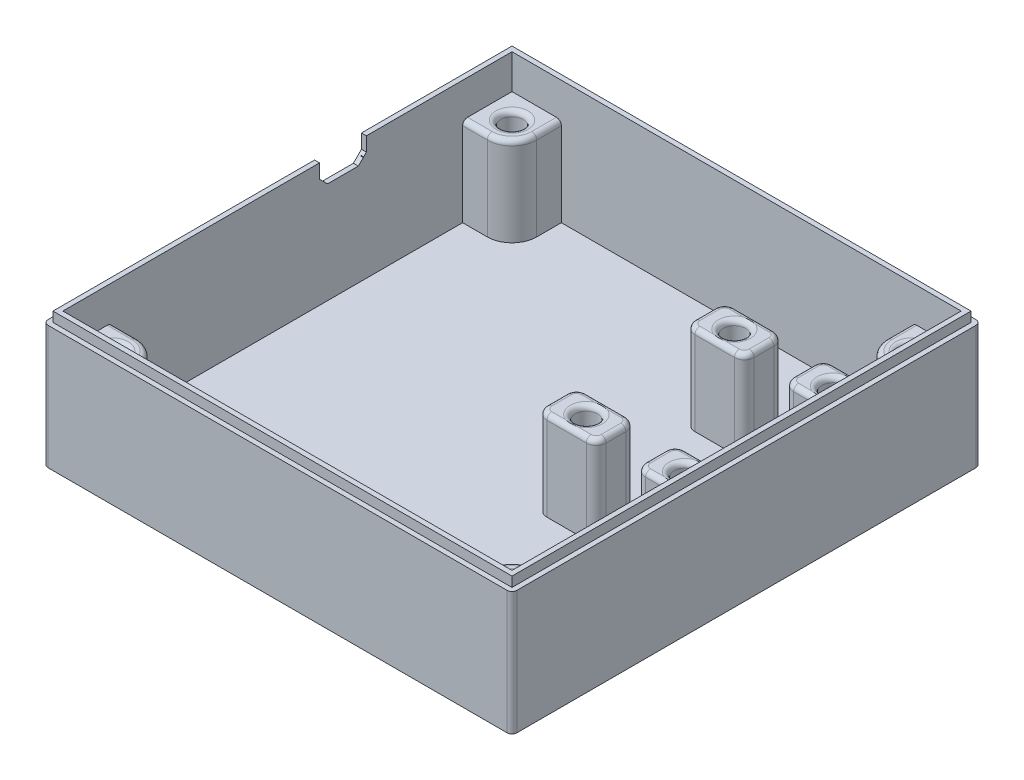
from build123d import *

# Parameters (mm, degrees)
SKETCH1_W           = 95
SKETCH1_H           = 95
BOSS_EXTRUDE1_DEPTH = 2
SKETCH2_W           = 95
SKETCH2_H           = 95
SKETCH2_W_2         = 91
SKETCH2_H_2         = 91
BOSS_EXTRUDE2_DEPTH = 25
BOSS_EXTRUDE3_DEPTH = 18
SKETCH4_R           = 2.25
CUT_EXTRUDE1_DEPTH  = 18
SKETCH6_R           = 2.25
BOSS_EXTRUDE4_DEPTH = 18
FILLET1_R           = 1
FILLET2_R           = 1
CUT_EXTRUDE2_REACH  = 111.591
CUT_EXTRUDE3_REACH  = 74.398
SKETCH8_W           = 0.5
SKETCH8_H           = 1.5
CUT_EXTRUDE4_DEPTH  = 0.8
FILLET3_R           = 1
FILLET4_R           = 1
SKETCH11_W          = 93
SKETCH11_H          = 93
CUT_EXTRUDE6_DEPTH  = 2
CUT_EXTRUDE7_REACH  = 110.899
CUT_EXTRUDE8_REACH  = 73.676
CUT_EXTRUDE9_DEPTH  = 1
FILLET5_R           = 1


with BuildPart() as part:
    # Sketch1 → Boss-Extrude1 (new body)
    with BuildSketch(Plane(origin=(0, 0, 0), x_dir=(1, 0, 0), z_dir=(0, 1, 0))):
        Rectangle(SKETCH1_W, SKETCH1_H)
    extrude(amount=BOSS_EXTRUDE1_DEPTH)

    # Sketch2 → Boss-Extrude2 (add)
    with BuildSketch(Plane(origin=(0, 2, 0), x_dir=(1, 0, 0), z_dir=(0, 1, 0))):
        Rectangle(SKETCH2_W, SKETCH2_H)
        Rectangle(SKETCH2_W_2, SKETCH2_H_2, mode=Mode.SUBTRACT)
    extrude(amount=BOSS_EXTRUDE2_DEPTH)

    # Sketch3 → Boss-Extrude3 (add)
    with BuildSketch(Plane(origin=(0, 2, 0), x_dir=(1, 0, 0), z_dir=(0, 1, 0))):
        with BuildLine():
            Line((-45.5, 45.5), (-35.5, 45.5))
            Line((-35.5, 45.5), (-35.5, 40.5))
            ThreePointArc((-35.5, 40.5), (-36.964466094, 36.964466094), (-40.5, 35.5))
            Line((-40.5, 35.5), (-45.5, 35.5))
            Line((-45.5, 35.5), (-45.5, 45.5))
        make_face()
        with BuildLine():
            Line((35.5, 45.5), (35.5, 40.5))
            ThreePointArc((35.5, 40.5), (36.964466094, 36.964466094), (40.5, 35.5))
            Line((40.5, 35.5), (45.5, 35.5))
            Line((45.5, 35.5), (45.5, 45.5))
            Line((45.5, 45.5), (35.5, 45.5))
        make_face()
        with BuildLine():
            Line((45.5, -45.5), (35.5, -45.5))
            Line((35.5, -45.5), (35.5, -40.5))
            ThreePointArc((35.5, -40.5), (36.964466094, -36.964466094), (40.5, -35.5))
            Line((40.5, -35.5), (45.5, -35.5))
            Line((45.5, -35.5), (45.5, -45.5))
        make_face()
        with BuildLine():
            Line((-35.5, -45.5), (-35.5, -40.5))
            ThreePointArc((-35.5, -40.5), (-36.964466094, -36.964466094), (-40.5, -35.5))
            Line((-40.5, -35.5), (-45.5, -35.5))
            Line((-45.5, -35.5), (-45.5, -45.5))
            Line((-45.5, -45.5), (-35.5, -45.5))
        make_face()
    extrude(amount=BOSS_EXTRUDE3_DEPTH)

    # Sketch4 → Cut-Extrude1 (cut)
    with BuildSketch(Plane(origin=(0, 20, 0), x_dir=(1, 0, 0), z_dir=(0, 1, 0))):
        with Locations(Location((-40.5, 40.5, 0), (0, 0, 270))):
            Circle(SKETCH4_R)
        with Locations(Location((40.5, 40.5, 0), (0, 0, 270))):
            Circle(SKETCH4_R)
        with Locations(Location((40.5, -40.5, 0), (0, 0, 270))):
            Circle(SKETCH4_R)
        with Locations(Location((-40.5, -40.5, 0), (0, 0, 270))):
            Circle(SKETCH4_R)
    extrude(amount=-CUT_EXTRUDE1_DEPTH, mode=Mode.SUBTRACT)

    # Sketch6 → Boss-Extrude4 (add)
    # profile 1 of 4: a face of its own
    with BuildSketch(Plane(origin=(0, 2, 0), x_dir=(1, 0, 0), z_dir=(0, 1, 0))):
        with BuildLine():
            Line((14.69, 30.37), (22.69, 30.37))
            ThreePointArc((22.69, 30.37), (24.104213562, 29.784213562), (24.69, 28.37))
            Line((24.69, 28.37), (24.69, 24.37))
            ThreePointArc((24.69, 24.37), (24.104213562, 22.955786438), (22.69, 22.37))
            Line((22.69, 22.37), (14.69, 22.37))
            ThreePointArc((14.69, 22.37), (13.275786438, 22.955786438), (12.69, 24.37))
            Line((12.69, 24.37), (12.69, 28.37))
            ThreePointArc((12.69, 28.37), (13.275786438, 29.784213562), (14.69, 30.37))
        make_face()
        with Locations(Location((18.69, 26.37, 0), (0, 0, 90))):
            Circle(SKETCH6_R, mode=Mode.SUBTRACT)
    # profile 2 of 4: a face of its own
    with BuildSketch(Plane(origin=(0, 2, 0), x_dir=(1, 0, 0), z_dir=(0, 1, 0))):
        with BuildLine():
            Line((45.5, 30.37), (45.5, 22.37))
            Line((45.5, 22.37), (34.69, 22.37))
            ThreePointArc((34.69, 22.37), (33.275786438, 22.955786438), (32.69, 24.37))
            Line((32.69, 24.37), (32.69, 28.37))
            ThreePointArc((32.69, 28.37), (33.275786438, 29.784213562), (34.69, 30.37))
            Line((34.69, 30.37), (45.5, 30.37))
        make_face()
        with Locations(Location((38.69, 26.37, 0), (0, 0, 90))):
            Circle(SKETCH6_R, mode=Mode.SUBTRACT)
    # profile 3 of 4: a face of its own
    with BuildSketch(Plane(origin=(0, 2, 0), x_dir=(1, 0, 0), z_dir=(0, 1, 0))):
        with BuildLine():
            Line((14.69, 0.37), (22.69, 0.37))
            ThreePointArc((22.69, 0.37), (24.104213562, -0.215786438), (24.69, -1.63))
            Line((24.69, -1.63), (24.69, -5.63))
            ThreePointArc((24.69, -5.63), (24.104213562, -7.044213562), (22.69, -7.63))
            Line((22.69, -7.63), (14.69, -7.63))
            ThreePointArc((14.69, -7.63), (13.275786438, -7.044213562), (12.69, -5.63))
            Line((12.69, -5.63), (12.69, -1.63))
            ThreePointArc((12.69, -1.63), (13.275786438, -0.215786438), (14.69, 0.37))
        make_face()
        with Locations(Location((18.69, -3.63, 0), (0, 0, 90))):
            Circle(SKETCH6_R, mode=Mode.SUBTRACT)
    # profile 4 of 4: a face of its own
    with BuildSketch(Plane(origin=(0, 2, 0), x_dir=(1, 0, 0), z_dir=(0, 1, 0))):
        with BuildLine():
            Line((45.5, 0.37), (45.5, -7.63))
            Line((45.5, -7.63), (34.69, -7.63))
            ThreePointArc((34.69, -7.63), (33.275786438, -7.044213562), (32.69, -5.63))
            Line((32.69, -5.63), (32.69, -1.63))
            ThreePointArc((32.69, -1.63), (33.275786438, -0.215786438), (34.69, 0.37))
            Line((34.69, 0.37), (45.5, 0.37))
        make_face()
        with Locations(Location((38.69, -3.63, 0), (0, 0, 90))):
            Circle(SKETCH6_R, mode=Mode.SUBTRACT)
    extrude(amount=BOSS_EXTRUDE4_DEPTH)

    # Fillet1
    # the kernel refuses this fillet: 1 mm, written as the material it takes off along each edge
    with BuildSketch(Plane(origin=(14.69, 20, 5.63), x_dir=(0, 0, 1), z_dir=(1, 0, 0))) as fillet1_piece_1:
        with BuildLine():
            CenterArc((2 - FILLET1_R, FILLET1_R), FILLET1_R, 270, 90)
            Line((2 - FILLET1_R, 0), (2, 0))
            Line((2, 0), (2, FILLET1_R))
        make_face()
    revolve(axis=Axis((14.69, 20, 5.63), (0, -1, 0)), revolution_arc=90, mode=Mode.SUBTRACT)
    with BuildSketch(Plane(origin=(22.69, 20, 7.63), x_dir=(0, -1, 0), z_dir=(-1, 0, 0)), Plane(origin=(14.69, 20, -0.37), x_dir=(0, -1, 0), z_dir=(1, 0, 0)), Plane(origin=(14.69, 20, -30.37), x_dir=(0, -1, 0), z_dir=(1, 0, 0)), Plane(origin=(22.69, 20, -22.37), x_dir=(0, -1, 0), z_dir=(-1, 0, 0))) as fillet1_piece_2:
        with BuildLine():
            CenterArc((FILLET1_R, -FILLET1_R), FILLET1_R, 90, 90)
            Line((0, -FILLET1_R), (0, 0))
            Line((0, 0), (FILLET1_R, 0))
        make_face()
    extrude(amount=8, mode=Mode.SUBTRACT)
    with BuildSketch(Plane(origin=(22.69, 20, 5.63), x_dir=(1, 0, 0), z_dir=(0, 0, -1))) as fillet1_piece_3:
        with BuildLine():
            CenterArc((2 - FILLET1_R, FILLET1_R), FILLET1_R, 270, 90)
            Line((2 - FILLET1_R, 0), (2, 0))
            Line((2, 0), (2, FILLET1_R))
        make_face()
    revolve(axis=Axis((22.69, 20, 5.63), (0, -1, 0)), revolution_arc=90, mode=Mode.SUBTRACT)
    with BuildSketch(Plane(origin=(24.69, 20, 1.63), x_dir=(0, -1, 0), z_dir=(0, 0, 1)), Plane(origin=(12.69, 20, 5.63), x_dir=(0, -1, 0), z_dir=(0, 0, -1)), Plane(origin=(12.69, 20, -24.37), x_dir=(0, -1, 0), z_dir=(0, 0, -1)), Plane(origin=(24.69, 20, -28.37), x_dir=(0, -1, 0), z_dir=(0, 0, 1))) as fillet1_piece_4:
        with BuildLine():
            CenterArc((FILLET1_R, -FILLET1_R), FILLET1_R, 90, 90)
            Line((0, -FILLET1_R), (0, 0))
            Line((0, 0), (FILLET1_R, 0))
        make_face()
    extrude(amount=4, mode=Mode.SUBTRACT)
    with BuildSketch(Plane(origin=(22.69, 20, 1.63), x_dir=(0, 0, -1), z_dir=(-1, 0, 0))) as fillet1_piece_5:
        with BuildLine():
            CenterArc((2 - FILLET1_R, FILLET1_R), FILLET1_R, 270, 90)
            Line((2 - FILLET1_R, 0), (2, 0))
            Line((2, 0), (2, FILLET1_R))
        make_face()
    revolve(axis=Axis((22.69, 20, 1.63), (0, -1, 0)), revolution_arc=90, mode=Mode.SUBTRACT)
    with BuildSketch(Plane(origin=(14.69, 20, 1.63), x_dir=(-1, 0, 0), z_dir=(0, 0, 1))) as fillet1_piece_6:
        with BuildLine():
            CenterArc((2 - FILLET1_R, FILLET1_R), FILLET1_R, 270, 90)
            Line((2 - FILLET1_R, 0), (2, 0))
            Line((2, 0), (2, FILLET1_R))
        make_face()
    revolve(axis=Axis((14.69, 20, 1.63), (0, -1, 0)), revolution_arc=90, mode=Mode.SUBTRACT)
    with BuildSketch(Plane(origin=(18.69, 20, 3.63), x_dir=(0, 0, -1), z_dir=(1, 0, 0))) as fillet1_piece_7:
        with BuildLine():
            CenterArc((2.25 + FILLET1_R, -FILLET1_R), FILLET1_R, 90, 90)
            Line((2.25, -FILLET1_R), (2.25, 0))
            Line((2.25, 0), (2.25 + FILLET1_R, 0))
        make_face()
    revolve(axis=Axis((18.69, 20, 3.63), (0, 1, 0)), mode=Mode.SUBTRACT)
    with BuildSketch(Plane(origin=(22.69, 20, -28.37), x_dir=(0, 0, -1), z_dir=(-1, 0, 0))) as fillet1_piece_8:
        with BuildLine():
            CenterArc((2 - FILLET1_R, FILLET1_R), FILLET1_R, 270, 90)
            Line((2 - FILLET1_R, 0), (2, 0))
            Line((2, 0), (2, FILLET1_R))
        make_face()
    revolve(axis=Axis((22.69, 20, -28.37), (0, -1, 0)), revolution_arc=90, mode=Mode.SUBTRACT)
    with BuildSketch(Plane(origin=(14.69, 20, -28.37), x_dir=(-1, 0, 0), z_dir=(0, 0, 1))) as fillet1_piece_9:
        with BuildLine():
            CenterArc((2 - FILLET1_R, FILLET1_R), FILLET1_R, 270, 90)
            Line((2 - FILLET1_R, 0), (2, 0))
            Line((2, 0), (2, FILLET1_R))
        make_face()
    revolve(axis=Axis((14.69, 20, -28.37), (0, -1, 0)), revolution_arc=90, mode=Mode.SUBTRACT)
    with BuildSketch(Plane(origin=(14.69, 20, -24.37), x_dir=(0, 0, 1), z_dir=(1, 0, 0))) as fillet1_piece_10:
        with BuildLine():
            CenterArc((2 - FILLET1_R, FILLET1_R), FILLET1_R, 270, 90)
            Line((2 - FILLET1_R, 0), (2, 0))
            Line((2, 0), (2, FILLET1_R))
        make_face()
    revolve(axis=Axis((14.69, 20, -24.37), (0, -1, 0)), revolution_arc=90, mode=Mode.SUBTRACT)
    with BuildSketch(Plane(origin=(22.69, 20, -24.37), x_dir=(1, 0, 0), z_dir=(0, 0, -1))) as fillet1_piece_11:
        with BuildLine():
            CenterArc((2 - FILLET1_R, FILLET1_R), FILLET1_R, 270, 90)
            Line((2 - FILLET1_R, 0), (2, 0))
            Line((2, 0), (2, FILLET1_R))
        make_face()
    revolve(axis=Axis((22.69, 20, -24.37), (0, -1, 0)), revolution_arc=90, mode=Mode.SUBTRACT)
    with BuildSketch(Plane(origin=(18.69, 20, -26.37), x_dir=(0, 0, -1), z_dir=(1, 0, 0))) as fillet1_piece_12:
        with BuildLine():
            CenterArc((2.25 + FILLET1_R, -FILLET1_R), FILLET1_R, 90, 90)
            Line((2.25, -FILLET1_R), (2.25, 0))
            Line((2.25, 0), (2.25 + FILLET1_R, 0))
        make_face()
    revolve(axis=Axis((18.69, 20, -26.37), (0, 1, 0)), mode=Mode.SUBTRACT)

    # Fillet2
    fillet2_edges = [part.edges().sort_by_distance(p)[0] for p in [
        (-40.5, 20, 38.25),
        (40.5, 20, 38.25),
        (40.5, 20, -42.75),
        (-40.5, 20, -42.75),
        (-43, 20, -35.5),
        (-36.964466094, 20, -36.964466094),
        (-35.5, 20, -43),
        (36.964466094, 20, -36.964466094),
        (43, 20, -35.5),
        (35.5, 20, -43),
        (36.964466094, 20, 36.964466094),
        (35.5, 20, 43),
        (43, 20, 35.5),
        (-36.964466094, 20, 36.964466094),
        (-43, 20, 35.5),
        (-35.5, 20, 43),
    ]]
    fillet(fillet2_edges, radius=FILLET2_R)

    # Sketch7 → Cut-Extrude2 (cut, up to next)
    with BuildSketch(Plane.ZY.offset(47.5), mode=Mode.PRIVATE) as cut_extrude2_sk1:
        Polygon((-15, 27), (-15, 24.55), (-13.95, 23.5), (-8.55, 23.5), (-7.5, 24.55), (-7.5, 27), align=None)
    cut_extrude2_tool1 = extrude(cut_extrude2_sk1.sketch, amount=-CUT_EXTRUDE2_REACH, mode=Mode.PRIVATE) & part.part
    add(cut_extrude2_tool1.solids().sort_by_distance((-47.5, 25.311378, -11.25))[0], mode=Mode.SUBTRACT)

    # Cut-Extrude3: up to this face of the body (flat: up to its plane)
    cut_extrude3_end = Plane(part.part.faces().sort_by_distance((-46.5, 23.5, -11.25))[0])
    # Sketch8 → Cut-Extrude3 (cut, up to the picked face)
    with BuildSketch(Plane(origin=(0, 27, 0), x_dir=(1, 0, 0), z_dir=(0, 1, 0)), mode=Mode.PRIVATE) as cut_extrude3_sk1:
        with Locations((-45.75, 7.8)):
            Rectangle(SKETCH8_W, SKETCH8_H)
    cut_extrude3_tool1 = split(extrude(cut_extrude3_sk1.sketch, amount=-CUT_EXTRUDE3_REACH, mode=Mode.PRIVATE), bisect_by=cut_extrude3_end, keep=Keep.BOTH, mode=Mode.PRIVATE)
    # Sketch8 → Cut-Extrude3 (cut, up to the picked face)
    with BuildSketch(Plane(origin=(0, 27, 0), x_dir=(1, 0, 0), z_dir=(0, 1, 0)), mode=Mode.PRIVATE) as cut_extrude3_sk2:
        with Locations((-45.75, 14.7)):
            Rectangle(SKETCH8_W, SKETCH8_H)
    cut_extrude3_tool2 = split(extrude(cut_extrude3_sk2.sketch, amount=-CUT_EXTRUDE3_REACH, mode=Mode.PRIVATE), bisect_by=cut_extrude3_end, keep=Keep.BOTH, mode=Mode.PRIVATE)
    add(cut_extrude3_tool1.solids().sort_by(Axis((-45.75, 27, -7.8), (0, -1, 0)))[0], mode=Mode.SUBTRACT)
    add(cut_extrude3_tool2.solids().sort_by(Axis((-45.75, 27, -14.7), (0, -1, 0)))[0], mode=Mode.SUBTRACT)

    # Sketch9 → Cut-Extrude4 (cut)
    with BuildSketch(Plane.ZY.offset(47.5)):
        Polygon((-6.5, 24.135786438), (-6.5, 27), (-7.5, 27), (-7.5, 24.55), (-8.55, 23.5), (-13.95, 23.5), (-15, 24.55), (-15, 27), (-16, 27), (-16, 24.135786438), (-14.364213562, 22.5), (-8.135786438, 22.5), align=None)
    extrude(amount=-CUT_EXTRUDE4_DEPTH, mode=Mode.SUBTRACT)

    # Fillet3
    fillet3_edges = [part.edges().sort_by_distance(p)[0] for p in [
        (47.5, 13.5, 47.5),
        (-47.5, 13.5, -47.5),
    ]]
    fillet(fillet3_edges, radius=FILLET3_R)

    # Fillet4
    fillet4_edges = [part.edges().sort_by_distance(p)[0] for p in [
        (-47.5, 13.5, 47.5),
        (47.5, 13.5, -47.5),
    ]]
    fillet(fillet4_edges, radius=FILLET4_R)

    # Sketch11 → Cut-Extrude6 (cut)
    with BuildSketch(Plane(origin=(0, 27, 0), x_dir=(1, 0, 0), z_dir=(0, 1, 0))):
        with BuildLine():
            Line((-46.5, 47.5), (46.5, 47.5))
            ThreePointArc((46.5, 47.5), (47.207106781, 47.207106781), (47.5, 46.5))
            Line((47.5, 46.5), (47.5, -46.5))
            ThreePointArc((47.5, -46.5), (47.207106781, -47.207106781), (46.5, -47.5))
            Line((46.5, -47.5), (-46.5, -47.5))
            ThreePointArc((-46.5, -47.5), (-47.207106781, -47.207106781), (-47.5, -46.5))
            Line((-47.5, -46.5), (-47.5, 46.5))
            ThreePointArc((-47.5, 46.5), (-47.207106781, 47.207106781), (-46.5, 47.5))
        make_face()
        Rectangle(SKETCH11_W, SKETCH11_H, mode=Mode.SUBTRACT)
    extrude(amount=-CUT_EXTRUDE6_DEPTH, mode=Mode.SUBTRACT)

    # Sketch12 → Cut-Extrude7 (cut, up to next)
    with BuildSketch(Plane.ZY.offset(46.7), mode=Mode.PRIVATE) as cut_extrude7_sk1:
        Polygon((-15, 25), (-16, 25), (-16, 24.135786438), (-14.364213562, 22.5), (-8.135786438, 22.5), (-6.5, 24.135786438), (-6.5, 25), (-7.5, 25), (-7.5, 24.55), (-8.55, 23.5), (-13.95, 23.5), (-15, 24.55), align=None)
    cut_extrude7_tool1 = extrude(cut_extrude7_sk1.sketch, amount=-CUT_EXTRUDE7_REACH, mode=Mode.PRIVATE) & part.part
    add(cut_extrude7_tool1.solids().sort_by_distance((-46.7, 23.417877, -11.25))[0], mode=Mode.SUBTRACT)

    # Sketch13 → Cut-Extrude8 (cut, up to next)
    with BuildSketch(Plane.XZ.offset(-25), mode=Mode.PRIVATE) as cut_extrude8_sk1:
        Polygon((-46.5, -15), (-46.5, -16), (-45.5, -16), (-45.5, -15.45), (-46, -15.45), (-46, -15), align=None)
    cut_extrude8_tool1 = extrude(cut_extrude8_sk1.sketch, amount=-CUT_EXTRUDE8_REACH, mode=Mode.PRIVATE) & part.part
    # Sketch13 → Cut-Extrude8 (cut, up to next)
    with BuildSketch(Plane.XZ.offset(-25), mode=Mode.PRIVATE) as cut_extrude8_sk2:
        Polygon((-46.5, -6.5), (-46.5, -7.5), (-46, -7.5), (-46, -7.05), (-45.5, -7.05), (-45.5, -6.5), align=None)
    cut_extrude8_tool2 = extrude(cut_extrude8_sk2.sketch, amount=-CUT_EXTRUDE8_REACH, mode=Mode.PRIVATE) & part.part
    add(cut_extrude8_tool1.solids().sort_by_distance((-46.072581, 25, -15.579839))[0], mode=Mode.SUBTRACT)
    add(cut_extrude8_tool2.solids().sort_by_distance((-46.072581, 25, -6.920161))[0], mode=Mode.SUBTRACT)

    # Sketch16 → Cut-Extrude9 (cut)
    with BuildSketch(Plane.ZY.offset(47.5)):
        Polygon((-6.5, 24.135786438), (-6.5, 25), (-4.5, 25), (-4.5, 23.307359313), (-7.307359313, 20.5), (-15.192640687, 20.5), (-18, 23.307359313), (-18, 25), (-16, 25), (-16, 24.135786438), (-14.364213562, 22.5), (-8.135786438, 22.5), align=None)
    extrude(amount=-CUT_EXTRUDE9_DEPTH, mode=Mode.SUBTRACT)

    # Fillet5
    # the kernel refuses this fillet: 1 mm, written as the material it adds along each edge
    with BuildSketch(Plane(origin=(38.69, 2, -26.37), x_dir=(0, 0, -1), z_dir=(1, 0, 0))) as fillet5_piece_1:
        with BuildLine():
            CenterArc((2.25 - FILLET5_R, FILLET5_R), FILLET5_R, 270, 90)
            Line((2.25 - FILLET5_R, 0), (2.25, 0))
            Line((2.25, 0), (2.25, FILLET5_R))
        make_face()
    revolve(axis=Axis((38.69, 2, -26.37), (0, 1, 0)))
    # the kernel refuses this fillet: 1 mm, written as the material it takes off along each edge
    with BuildSketch(Plane(origin=(45.5, 20, -22.37), x_dir=(0, -1, 0), z_dir=(-1, 0, 0)), Plane(origin=(45.5, 20, 7.63), x_dir=(0, -1, 0), z_dir=(-1, 0, 0))) as fillet5_2_piece_1:
        with BuildLine():
            CenterArc((FILLET5_R, -FILLET5_R), FILLET5_R, 90, 90)
            Line((0, -FILLET5_R), (0, 0))
            Line((0, 0), (FILLET5_R, 0))
        make_face()
    extrude(amount=10.81, mode=Mode.SUBTRACT)
    with BuildSketch(Plane(origin=(34.69, 20, -30.37), x_dir=(0, 0, 1), z_dir=(1, 0, 0)), Plane(origin=(34.69, 20, -0.37), x_dir=(0, 0, 1), z_dir=(1, 0, 0))) as fillet5_2_piece_2:
        with BuildLine():
            CenterArc((FILLET5_R, FILLET5_R), FILLET5_R, 180, 90)
            Line((0, FILLET5_R), (0, 0))
            Line((0, 0), (FILLET5_R, 0))
        make_face()
    extrude(amount=10.81, mode=Mode.SUBTRACT)
    with BuildSketch(Plane(origin=(34.69, 20, -28.37), x_dir=(-1, 0, 0), z_dir=(0, 0, 1))) as fillet5_2_piece_3:
        with BuildLine():
            CenterArc((2 - FILLET5_R, FILLET5_R), FILLET5_R, 270, 90)
            Line((2, FILLET5_R), (2, 0))
            Line((2, 0), (2 - FILLET5_R, 0))
        make_face()
    revolve(axis=Axis((34.69, 20, -28.37), (0, -1, 0)), revolution_arc=90, mode=Mode.SUBTRACT)
    with BuildSketch(Plane(origin=(32.69, 20, -24.37), x_dir=(1, 0, 0), z_dir=(0, 0, -1)), Plane(origin=(32.69, 20, 5.63), x_dir=(1, 0, 0), z_dir=(0, 0, -1))) as fillet5_2_piece_4:
        with BuildLine():
            CenterArc((FILLET5_R, FILLET5_R), FILLET5_R, 180, 90)
            Line((0, FILLET5_R), (0, 0))
            Line((0, 0), (FILLET5_R, 0))
        make_face()
    extrude(amount=4, mode=Mode.SUBTRACT)
    with BuildSketch(Plane(origin=(34.69, 20, -24.37), x_dir=(0, 0, 1), z_dir=(1, 0, 0))) as fillet5_2_piece_5:
        with BuildLine():
            CenterArc((2 - FILLET5_R, FILLET5_R), FILLET5_R, 270, 90)
            Line((2, FILLET5_R), (2, 0))
            Line((2, 0), (2 - FILLET5_R, 0))
        make_face()
    revolve(axis=Axis((34.69, 20, -24.37), (0, -1, 0)), revolution_arc=90, mode=Mode.SUBTRACT)
    with BuildSketch(Plane(origin=(38.69, 20, -26.37), x_dir=(0, 0, -1), z_dir=(1, 0, 0))) as fillet5_2_piece_6:
        with BuildLine():
            CenterArc((2.25 + FILLET5_R, -FILLET5_R), FILLET5_R, 90, 90)
            Line((2.25, -FILLET5_R), (2.25, 0))
            Line((2.25, 0), (2.25 + FILLET5_R, 0))
        make_face()
    revolve(axis=Axis((38.69, 20, -26.37), (0, 1, 0)), mode=Mode.SUBTRACT)
    with BuildSketch(Plane(origin=(34.69, 20, 1.63), x_dir=(-1, 0, 0), z_dir=(0, 0, 1))) as fillet5_2_piece_7:
        with BuildLine():
            CenterArc((2 - FILLET5_R, FILLET5_R), FILLET5_R, 270, 90)
            Line((2, FILLET5_R), (2, 0))
            Line((2, 0), (2 - FILLET5_R, 0))
        make_face()
    revolve(axis=Axis((34.69, 20, 1.63), (0, -1, 0)), revolution_arc=90, mode=Mode.SUBTRACT)
    with BuildSketch(Plane(origin=(34.69, 20, 5.63), x_dir=(0, 0, 1), z_dir=(1, 0, 0))) as fillet5_2_piece_8:
        with BuildLine():
            CenterArc((2 - FILLET5_R, FILLET5_R), FILLET5_R, 270, 90)
            Line((2, FILLET5_R), (2, 0))
            Line((2, 0), (2 - FILLET5_R, 0))
        make_face()
    revolve(axis=Axis((34.69, 20, 5.63), (0, -1, 0)), revolution_arc=90, mode=Mode.SUBTRACT)
    with BuildSketch(Plane(origin=(38.69, 20, 3.63), x_dir=(0, 0, -1), z_dir=(1, 0, 0))) as fillet5_2_piece_9:
        with BuildLine():
            CenterArc((2.25 + FILLET5_R, -FILLET5_R), FILLET5_R, 90, 90)
            Line((2.25, -FILLET5_R), (2.25, 0))
            Line((2.25, 0), (2.25 + FILLET5_R, 0))
        make_face()
    revolve(axis=Axis((38.69, 20, 3.63), (0, 1, 0)), mode=Mode.SUBTRACT)


solid = part.part
